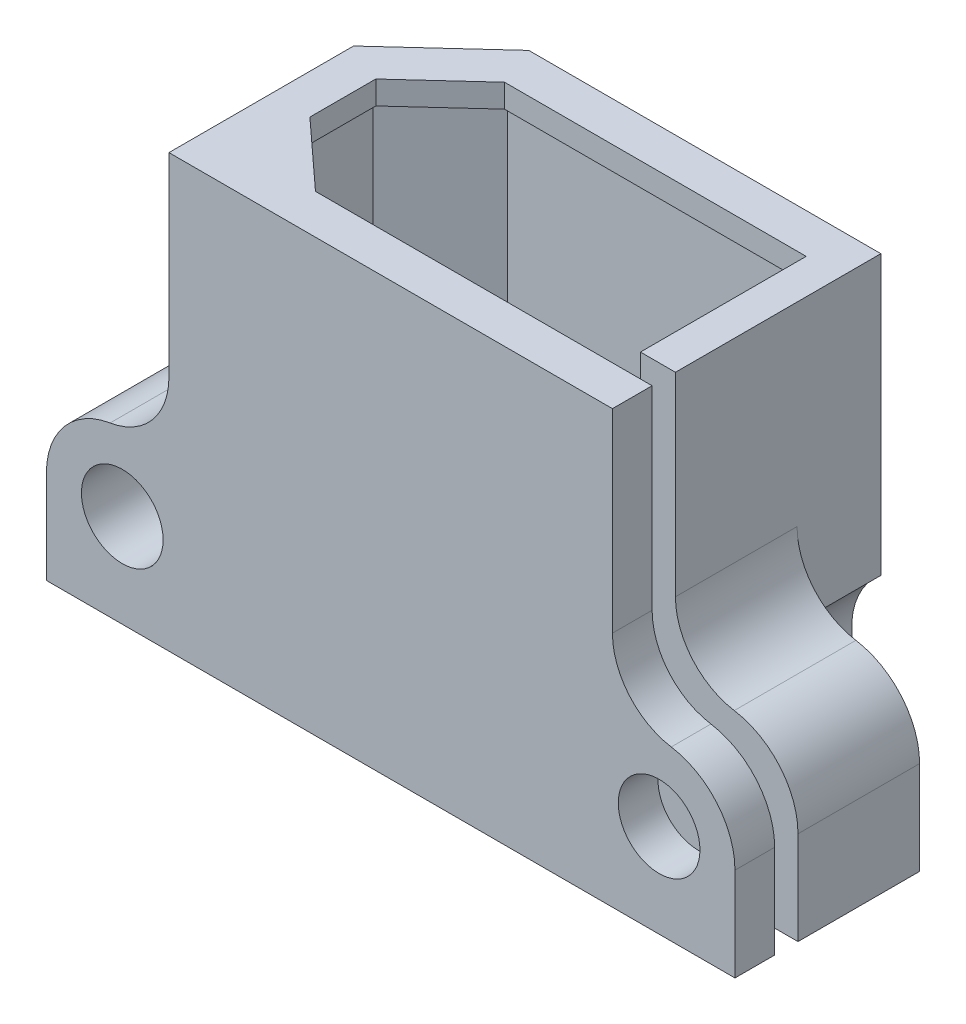
from build123d import *

# Parameters (mm, degrees)
BOSS_EXTRUDE1_DEPTH = 16.5
BOSS_EXTRUDE7_DEPTH = 1
BOSS_EXTRUDE8_DEPTH = 1
SKETCH9_R           = 1.75
BOSS_EXTRUDE9_DEPTH = 7.909853
CUT_EXTRUDE2_START  = -3.590147425
SKETCH11_R          = 3.25
CUT_EXTRUDE2_DEPTH  = 3.590147425
CUT_EXTRUDE3_START  = -18.5
SKETCH12_W          = 5.25
SKETCH12_H          = 1
SKETCH12_W_2        = 1.5
CUT_EXTRUDE3_DEPTH  = 18.5
FILLET1_R           = 3


with BuildPart() as part:
    # Sketch1 → Boss-Extrude1 (new body)
    with BuildSketch(Plane(origin=(0, 0, 0), x_dir=(1, 0, 0), z_dir=(0, 1, 0))):
        Polygon((-7.219839172, 4.25), (-5, 4.25), (8, 4.25), (8, -4.25), (-5, -4.25), (-7.219839172, -4.25), (-5.583475536, -5.75), (9.5, -5.75), (9.5, 5.75), (-5.583475536, 5.75), align=None)
        Polygon((-8, -4.25), (-8, -3.534852575), (-9.5, -2.159852575), (-9.5, -5.75), (-5.583475536, -5.75), (-7.219839172, -4.25), align=None)
        Polygon((-8, -1.5), (-8, 1.5), (-8, 3.534852575), (-9.5, 2.159852575), (-9.5, -2.159852575), (-8, -3.534852575), align=None)
        Polygon((-8, 1.5), (-5, 4.25), (-7.219839172, 4.25), (-8, 3.534852575), align=None)
        Polygon((-5, -4.25), (-8, -1.5), (-8, -3.534852575), (-7.219839172, -4.25), align=None)
        Polygon((-7.219839172, -4.25), (-8, -3.534852575), (-8, -4.25), align=None)
    extrude(amount=BOSS_EXTRUDE1_DEPTH)

    # Sketch7 → Boss-Extrude7 (add)
    # profile 1 of 2: a face of its own
    with BuildSketch(Plane(origin=(0, 16.5, 0), x_dir=(1, 0, 0), z_dir=(0, 1, 0))):
        Polygon((9.5, 5.75), (-5.583475536, 5.75), (-9.5, 2.159852575), (-9.5, -5.75), (9.5, -5.75), align=None)
        Polygon((8, -4.25), (-5, -4.25), (-8, -1.5), (-8, 1.5), (-5, 4.25), (8, 4.25), align=None, mode=Mode.SUBTRACT)
    # profile 2 of 2: a face of its own
    with BuildSketch(Plane(origin=(0, 16.5, 0), x_dir=(1, 0, 0), z_dir=(0, 1, 0))):
        Polygon((-4.922203262, 4.05), (7.8, 4.05), (8, 4.05), (8, 4.25), (-5, 4.25), (-8, 1.5), (-8, -1.5), (-5, -4.25), (8, -4.25), (8, -4.05), (7.8, -4.05), (-4.922203262, -4.05), (-7.8, -1.412019657), (-7.8, 1.412019657), align=None)
    extrude(amount=BOSS_EXTRUDE7_DEPTH)

    # Sketch8 → Boss-Extrude8 (add)
    with BuildSketch(Plane.XZ):
        Polygon((-9.5, -2.159852575), (-5.583475536, -5.75), (9.5, -5.75), (9.5, 5.75), (-9.5, 5.75), align=None)
        Polygon((8, 4.05), (-4.922203262, 4.05), (-7.8, 1.412019657), (-7.8, -1.412019657), (-4.922203262, -4.05), (8, -4.05), align=None, mode=Mode.SUBTRACT)
    extrude(amount=BOSS_EXTRUDE8_DEPTH)

    # Sketch9 → Boss-Extrude9 (add)
    # profile 1 of 4: a face of its own
    with BuildSketch(Plane.XY.offset(5.75)):
        with BuildLine():
            Line((-9.5, 0.438262309), (-9.5, 5.561737691))
            ThreePointArc((-9.5, 5.561737691), (-12.925219281, 5.920830361), (-14.75, 3))
            ThreePointArc((-14.75, 3), (-12.925219281, 0.079169639), (-9.5, 0.438262309))
        make_face()
        with Locations((-11.5, 3)):
            Circle(SKETCH9_R, mode=Mode.SUBTRACT)
    # profile 2 of 4: a face of its own
    with BuildSketch(Plane.XY.offset(5.75)):
        with BuildLine():
            ThreePointArc((14.75, 3), (12.925219281, 5.920830361), (9.5, 5.561737691))
            Line((9.5, 5.561737691), (9.5, 0.438262309))
            ThreePointArc((9.5, 0.438262309), (12.925219281, 0.079169639), (14.75, 3))
        make_face()
        with Locations((11.5, 3)):
            Circle(SKETCH9_R, mode=Mode.SUBTRACT)
    # profile 3 of 4: a face of its own
    with BuildSketch(Plane.XY.offset(5.75)):
        with BuildLine():
            Line((-9.5, -1), (-9.5, 0.438262309))
            ThreePointArc((-9.5, 0.438262309), (-12.925219281, 0.079169639), (-14.75, 3))
            Line((-14.75, 3), (-14.75, -1))
            Line((-14.75, -1), (-9.5, -1))
        make_face()
    # profile 4 of 4: a face of its own
    with BuildSketch(Plane.XY.offset(5.75)):
        with BuildLine():
            ThreePointArc((14.75, 3), (12.925219281, 0.079169639), (9.5, 0.438262309))
            Line((9.5, 0.438262309), (9.5, -1))
            Line((9.5, -1), (14.75, -1))
            Line((14.75, -1), (14.75, 3))
        make_face()
    extrude(amount=-BOSS_EXTRUDE9_DEPTH)

    # Sketch11 → Cut-Extrude2 (cut)
    with BuildSketch(Plane(origin=(0, 0, -5.75), x_dir=(-1, 0, 0), z_dir=(0, 0, -1)).offset(CUT_EXTRUDE2_START)):
        with Locations((-11.5, 3)):
            Circle(SKETCH11_R)
        with Locations((11.5, 3)):
            Circle(SKETCH11_R)
    extrude(amount=CUT_EXTRUDE2_DEPTH, mode=Mode.SUBTRACT)

    # Sketch12 → Cut-Extrude3 (cut)
    with BuildSketch(Plane(origin=(0, 17.5, 0), x_dir=(1, 0, 0), z_dir=(0, 1, 0)).offset(CUT_EXTRUDE3_START)):
        with Locations((12.125, -3.55)):
            Rectangle(SKETCH12_W, SKETCH12_H)
        with Locations((8.75, -3.55)):
            Rectangle(SKETCH12_W_2, SKETCH12_H)
    extrude(amount=CUT_EXTRUDE3_DEPTH, mode=Mode.SUBTRACT)

    # Fillet1
    # the kernel refuses this fillet: 3 mm, written as the material it adds along each edge
    with BuildSketch(Plane(origin=(-9.5, 5.561737691, 5.75), x_dir=(0, 1, 0), z_dir=(0, 0, -1))) as fillet1_piece_1_section:
        with BuildLine():
            CenterArc((3.607743648, -3), FILLET1_R, 90, 80.793103779)
            ThreePointArc((0.646392605, -2.52), (0.5863481, -1.192500248), (0, 0))
            Line((0, 0), (3.607743648, 0))
        make_face()
    fillet1_piece_1 = extrude(amount=16.929211695, mode=Mode.PRIVATE)
    fillet1_piece_1 = split(fillet1_piece_1, bisect_by=Plane(origin=(-10.050248637, 6.751557593, -2.159853), z_dir=(0, 0, 1)), keep=Keep.TOP, mode=Mode.PRIVATE)
    add(fillet1_piece_1)
    with BuildSketch(Plane(origin=(9.5, 5.561737691, 12.06935912), x_dir=(0.968641781969148, 0.24846146225045335, 0), z_dir=(0, 0, -1))) as fillet1_piece_2_section:
        with BuildLine():
            CenterArc((3.802310608, -2.749226849), FILLET1_R, 113.593384333, 80.793103779)
            Line((0.896385262, -3.494611236), (0, 0))
            ThreePointArc((0, 0), (1.300790471, -0.271670913), (2.601580942, 0))
        make_face()
    fillet1_piece_2 = extrude(amount=23.248570816, mode=Mode.PRIVATE)
    fillet1_piece_2 = split(fillet1_piece_2, bisect_by=Plane(origin=(10.078407886, 6.738604844, 5.75), z_dir=(0, 0, -1)), keep=Keep.TOP, mode=Mode.PRIVATE)
    fillet1_piece_2 = split(fillet1_piece_2, bisect_by=Plane(origin=(10.078407886, 6.738604844, 4.05), z_dir=(0, 0, 1)), keep=Keep.TOP, mode=Mode.PRIVATE)
    add(fillet1_piece_2)
    with BuildSketch(Plane(origin=(9.5, 5.561737691, 3.05), x_dir=(0.9686417819691505, 0.24846146225044377, 0), z_dir=(0, 0, -1))) as fillet1_piece_3:
        with BuildLine():
            CenterArc((3.802310608, -2.749226849), FILLET1_R, 113.593384333, 80.793103779)
            Line((0.896385262, -3.494611236), (0, 0))
            ThreePointArc((0, 0), (1.300790471, -0.271670913), (2.601580942, 0))
        make_face()
    extrude(amount=5.209852575)
    with BuildSketch(Plane(origin=(9.5, 5.561737691, 5.75), x_dir=(0.9686417819691505, 0.24846146225044377, 0), z_dir=(0, 0, -1))) as fillet1_piece_4:
        with BuildLine():
            CenterArc((3.802310608, -2.749226849), FILLET1_R, 113.593384333, 80.793103779)
            Line((0.896385262, -3.494611236), (0, 0))
            ThreePointArc((0, 0), (1.300790471, -0.271670913), (2.601580942, 0))
        make_face()
    extrude(amount=1.7)
    with BuildSketch(Plane(origin=(9.5, 5.561737691, 14.76935912), x_dir=(0.968641781969148, 0.24846146225045335, 0), z_dir=(0, 0, -1))) as fillet1_piece_5_section:
        with BuildLine():
            CenterArc((3.802310608, -2.749226849), FILLET1_R, 113.593384333, 80.793103779)
            Line((0.896385262, -3.494611236), (0, 0))
            ThreePointArc((0, 0), (1.300790471, -0.271670913), (2.601580942, 0))
        make_face()
    fillet1_piece_5 = extrude(amount=19.738718241, mode=Mode.PRIVATE)
    fillet1_piece_5 = split(fillet1_piece_5, bisect_by=Plane(origin=(10.078407886, 6.738604844, 3.05), z_dir=(0, 0, -1)), keep=Keep.TOP, mode=Mode.PRIVATE)
    fillet1_piece_5 = split(fillet1_piece_5, bisect_by=Plane(origin=(10.078407886, 6.738604844, -2.159852575), z_dir=(0, 0, 1)), keep=Keep.TOP, mode=Mode.PRIVATE)
    add(fillet1_piece_5)


solid = part.part
